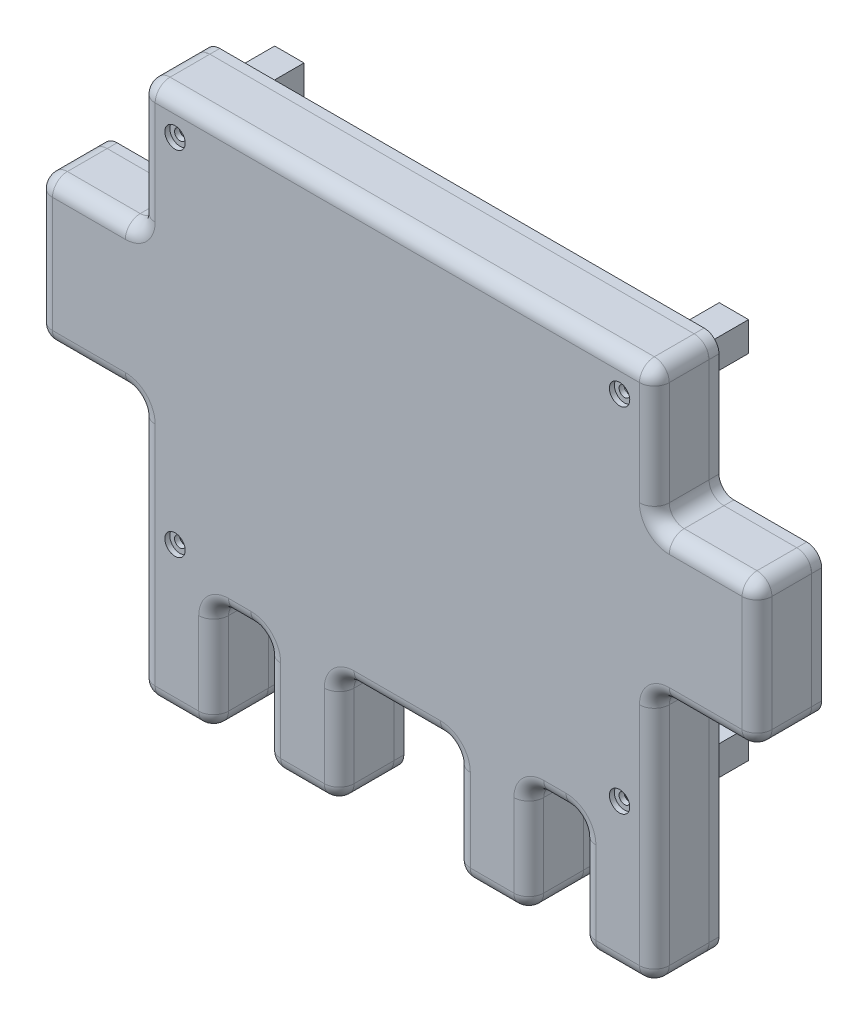
from build123d import *

# Parameters (mm, degrees)
PADTOP_W                  = 77.3
PADTOP_H                  = 39.099999999999994
PADTOP_W_2                = 20.65574575464899
PADTOP_H_2                = 29.19565574217878
PADTOP_R                  = 4.499999999999992
PADTOP_W_3                = 14.763576239839747
PADTOP_H_3                = 22.646815710584427
PADTOP_W_4                = 14.76357623983975
PADTOP_H_4                = 22.646815710584438
EXTRUDE_1_DEPTH           = 3
EXTRUDE_START             = -2
PADTOP_8_W                = 14.100000000000016
PADTOP_8_H                = 14.100000000000009
PADTOP_8_W_2              = 14.099999999999994
PADTOP_8_W_3              = 14.100000000000023
PADTOP_8_W_4              = 14.100000000000001
PADTOP_8_H_2              = 14.100000000000001
PADTOP_8_H_3              = 14.100000000000005
PADTOP_8_R                = 4.499999999999992
EXTRUDE_4_DEPTH           = 2
EXTRUDE_6_DEPTH           = 11
FILLET_2_R                = 3
SHELL_1_T                 = -2
FILLET_4_R                = 3
SKETCH_5_W                = 2
SKETCH_5_H                = 2.0000000000000018
SKETCH_5_W_2              = 3.999999999999986
SKETCH_5_H_2              = 4.000000000000002
SKETCH_5_W_3              = 4
SKETCH_5_W_4              = 2.000000000000014
SKETCH_5_W_5              = 4.000000000000007
SKETCH_5_H_3              = 4
SKETCH_5_W_6              = 3.9999999999999787
SKETCH_5_W_7              = 5.8999999999999915
SKETCH_5_H_4              = 5.900000000000001
SKETCH_5_W_8              = 1.8999999999999915
SKETCH_5_H_5              = 1.8999999999999986
SKETCH_5_H_6              = 5.900000000000006
SKETCH_5_W_9              = 1.9000000000000057
SKETCH_5_H_7              = 1.8999999999999915
SKETCH_5_W_10             = 5.899999999999999
SKETCH_5_W_11             = 1.899999999999995
EXTRUDE_9_DEPTH           = 10
SKETCH_7_R                = 1.1000000000000003
SKETCH_7_R_2              = 1.100000000000007
SKETCH_7_R_3              = 1.100000000000006
SKETCH_7_R_4              = 1.0999999999999992
CUT_EXTRUDE_1_DEPTH       = 2
CUT_EXTRUDE_START         = 10
CUT_EXTRUDE_2_OUTLINE_R   = 2.05
CUT_EXTRUDE_2_OUTLINE_R_2 = 1.1
CUT_EXTRUDE_2_DEPTH       = 1


# Read off the part's stored shape, not the designer's step: 除料-伸長2
with BuildPart() as part:
    # padTop → 填料-伸長1 (new body)
    # profile 1 of 9: a face of its own
    with BuildSketch(Plane.XY):
        Polygon((124.13033501568816, 70.45257702927987), (20.69269788144798, 70.45257702927987), (20.69269788144798, 43.68260894391669), (20.69269788144798, 38.79106377956692), (24.836952126799048, 38.79106377956692), (24.836952126799048, 19.37849836608769), (20.692697881447977, 19.37849836608769), (20.69269788144798, 14.486953201737919), (20.69269788144798, -14.488569064052683), (35.45627412128773, -14.488569064052687), (45.95627412128772, -14.488569064052687), (60.719850361127456, -14.488569064052687), (84.10318253600873, -14.488569064052687), (98.86675877584847, -14.488569064052687), (109.3667587758484, -14.488569064052687), (124.13033501568816, -14.488569064052687), (124.13033501568816, 14.309507687934257), (124.13033501568816, 43.505163430113036), align=None)
        with Locations((72.41151644856805, 11.013549731684844)):
            Rectangle(PADTOP_W, PADTOP_H, mode=Mode.SUBTRACT)
        Polygon((32.9132584783268, 41.22637289448324), (32.91325847832679, 61.22637289448325), (52.913258478326796, 61.22637289448325), (52.9132584783268, 41.22637289448324), align=None, mode=Mode.SUBTRACT)
        Polygon((92.073451812104, 41.22637289448324), (92.073451812104, 61.22637289448324), (112.073451812104, 61.22637289448325), (112.07345181210398, 41.22637289448324), align=None, mode=Mode.SUBTRACT)
    # profile 2 of 9: a face of its own
    with BuildSketch(Plane.XY):
        with Locations((134.45820789301266, 28.907335559023647)):
            Rectangle(PADTOP_W_2, PADTOP_H_2)
        with Locations((129.98608077033714, 29.084781072827305)):
            Circle(PADTOP_R, mode=Mode.SUBTRACT)
    # profile 3 of 9: a face of its own
    with BuildSketch(Plane.XY):
        Polygon((20.69269788144798, 38.79106377956692), (20.69269788144798, 43.68260894391669), (0.03695212679904358, 43.68260894391669), (0.03695212679905203, 14.486953201737915), (20.69269788144798, 14.486953201737915), (20.69269788144798, 19.37849836608769), (4.836952126799051, 19.378498366087687), (4.836952126799049, 38.79106377956692), align=None)
    # profile 4 of 9: a face of its own
    with BuildSketch(Plane.XY):
        Polygon((112.073451812104, 61.22637289448325), (112.07345181210398, 41.22637289448324), (92.073451812104, 41.22637289448324), (92.073451812104, 61.22637289448324), align=None)
        Polygon((96.52345181210397, 56.776372894483245), (107.62345181210398, 56.776372894483245), (107.62345181210398, 45.676372894483244), (96.52345181210399, 45.676372894483244), align=None, mode=Mode.SUBTRACT)
    # profile 5 of 9: a face of its own
    with BuildSketch(Plane.XY):
        Polygon((52.913258478326796, 61.22637289448325), (52.9132584783268, 41.22637289448324), (32.9132584783268, 41.22637289448324), (32.91325847832679, 61.22637289448325), align=None)
        Polygon((37.36325847832679, 56.776372894483245), (48.46325847832679, 56.776372894483245), (48.46325847832679, 45.676372894483244), (37.363258478326784, 45.676372894483244), align=None, mode=Mode.SUBTRACT)
    # profile 6 of 9: a face of its own
    with BuildSketch(Plane.XY):
        with Locations((28.074486001367852, -25.811976919344897)):
            Rectangle(PADTOP_W_3, PADTOP_H_3)
    # profile 7 of 9: a face of its own
    with BuildSketch(Plane.XY):
        Polygon((45.95627412128772, -14.488569064052673), (45.95627412128772, -37.13538477463711), (60.719850361127456, -37.13538477463711), (60.71985036112745, -14.488569064052673), align=None)
    # profile 8 of 9: a face of its own
    with BuildSketch(Plane.XY):
        with Locations((91.4849706559286, -25.811976919344893)):
            Rectangle(PADTOP_W_4, PADTOP_H_4)
    # profile 9 of 9: a face of its own
    with BuildSketch(Plane.XY):
        Polygon((124.13033501568816, -14.488569064052687), (124.13033501568816, -37.13538477463711), (109.3667587758484, -37.13538477463711), (109.3667587758484, -14.488569064052696), align=None)
    extrude(amount=EXTRUDE_1_DEPTH)

    # padTop<8> → 填料-伸長4 (add)
    with BuildSketch(Plane.XY.offset(EXTRUDE_START)):
        Polygon((124.13033501568816, 70.45257702927987), (20.69269788144798, 70.45257702927987), (20.69269788144797, 43.682608943916684), (0.03695212679904358, 43.68260894391669), (0.03695212679905203, 14.486953201737915), (20.69269788144798, 14.486953201737915), (20.69269788144798, -37.13538477463711), (35.45627412128773, -37.13538477463711), (35.45627412128773, -14.488569064052687), (45.95627412128772, -14.488569064052687), (45.95627412128772, -37.13538477463711), (60.719850361127456, -37.13538477463711), (60.71985036112745, -14.488569064052673), (84.10318253600873, -14.488569064052685), (84.10318253600873, -37.13538477463711), (98.86675877584847, -37.13538477463711), (98.86675877584847, -14.488569064052673), (109.3667587758484, -14.488569064052685), (109.3667587758484, -37.13538477463711), (124.13033501568816, -37.13538477463711), (124.13033501568816, 14.309507687934257), (144.78608077033715, 14.309507687934257), (144.78608077033715, 43.505163430113036), (124.13033501568816, 43.505163430113036), align=None)
        with Locations((43.76151644856806, 1.463549731684843)):
            Rectangle(PADTOP_8_W, PADTOP_8_H, mode=Mode.SUBTRACT)
        with Locations((62.86151644856807, 1.4635497316848411)):
            Rectangle(PADTOP_8_W_2, PADTOP_8_H, mode=Mode.SUBTRACT)
        Polygon((74.9115164485681, -5.586450268315154), (74.91151644856807, 8.513549731684844), (89.01151644856807, 8.513549731684845), (89.01151644856807, -5.586450268315156), align=None, mode=Mode.SUBTRACT)
        with Locations((101.06151644856807, 1.463549731684843)):
            Rectangle(PADTOP_8_W_3, PADTOP_8_H, mode=Mode.SUBTRACT)
        with Locations((43.76151644856806, 20.563549731684844)):
            Rectangle(PADTOP_8_W_4, PADTOP_8_H_2, mode=Mode.SUBTRACT)
        Polygon((55.81151644856807, 13.51354973168484), (55.81151644856807, 27.613549731684838), (69.91151644856808, 27.613549731684838), (69.91151644856808, 13.513549731684842), align=None, mode=Mode.SUBTRACT)
        Polygon((74.91151644856808, 13.51354973168484), (74.91151644856807, 27.613549731684838), (89.01151644856807, 27.613549731684834), (89.01151644856807, 13.51354973168484), align=None, mode=Mode.SUBTRACT)
        with Locations((101.06151644856809, 20.563549731684844)):
            Rectangle(PADTOP_8_W_2, PADTOP_8_H_3, mode=Mode.SUBTRACT)
        Polygon((20.692697881447977, 22.034781072827304), (7.786952126799051, 22.034781072827304), (7.786952126799052, 36.134781072827295), (20.69269788144797, 36.134781072827295), align=None, mode=Mode.SUBTRACT)
        Polygon((92.073451812104, 41.22637289448324), (92.073451812104, 61.22637289448324), (112.073451812104, 61.22637289448325), (112.07345181210398, 41.22637289448324), align=None, mode=Mode.SUBTRACT)
        Polygon((32.9132584783268, 41.22637289448324), (32.91325847832679, 61.22637289448325), (52.913258478326796, 61.22637289448325), (52.9132584783268, 41.22637289448324), align=None, mode=Mode.SUBTRACT)
        with Locations((129.98608077033714, 29.084781072827305)):
            Circle(PADTOP_8_R, mode=Mode.SUBTRACT)
    extrude(amount=EXTRUDE_4_DEPTH)

    # 圓角4
    fillet_4_edges = [part.edges().sort_by_distance(p)[0] for p in [
        (10.364825004123515, 14.486953201737915, 3),
        (35.45627412128773, -37.13538477463711, 0.5),
        (20.69269788144798, -37.13538477463711, 0.5),
        (35.45627412128773, -25.8119769193449, 3),
        (28.074486001367852, -37.13538477463711, 3),
        (60.719850361127456, -37.13538477463711, 0.5),
        (45.95627412128772, -37.13538477463711, 0.5),
        (45.95627412128772, -25.811976919344893, 3),
        (60.719850361127456, -25.811976919344893, 3),
        (53.33806224120759, -37.13538477463711, 3),
        (98.86675877584847, -37.13538477463711, 0.5),
        (84.10318253600873, -37.13538477463711, 0.5),
        (84.10318253600873, -25.811976919344893, 3),
        (98.86675877584847, -25.811976919344893, 3),
        (91.4849706559286, -37.13538477463711, 3),
        (124.13033501568816, -37.13538477463711, 0.5),
        (109.3667587758484, -37.13538477463711, 0.5),
        (109.3667587758484, -25.811976919344904, 3),
        (116.74854689576827, -37.13538477463711, 3),
        (20.69269788144798, -11.324215786449598, 3),
        (124.13033501568816, -11.412938543351427, 3),
        (134.45820789301266, 14.309507687934257, 3),
        (144.78608077033715, 28.907335559023647, 3),
        (134.45820789301266, 43.505163430113036, 3),
        (124.13033501568816, 56.978870229696454, 3),
        (72.41151644856808, 70.45257702927987, 3),
        (0.03695212679905136, 14.486953201737915, 0.5),
        (0.03695212679904334, 43.68260894391669, 0.5),
        (20.692697881447963, 43.68260894391669, 0.5),
        (20.69269788144798, 70.45257702927987, 0.5),
        (124.13033501568816, 70.45257702927987, 0.5),
        (124.13033501568816, 43.505163430113036, 0.5),
        (144.78608077033715, 43.505163430113036, 0.5),
        (144.78608077033715, 14.309507687934257, 0.5),
        (124.13033501568816, 14.309507687934257, 0.5),
        (20.69269788144798, 57.06759298659828, 3),
        (20.69269788144798, 14.486953201737915, 0.5),
        (10.364825004123498, 43.68260894391669, 3),
        (0.03695212679904757, 29.084781072827305, 3),
        (40.70627412128772, -14.488569064052685, 3),
        (72.4115164485681, -14.488569064052685, 3),
        (104.11675877584844, -14.488569064052685, 3),
        (109.3667587758484, -14.488569064052694, 0.5),
        (98.86675877584847, -14.488569064052676, 0.5),
        (84.10318253600873, -14.488569064052676, 0.5),
        (60.719850361127456, -14.488569064052676, 0.5),
        (45.95627412128772, -14.488569064052676, 0.5),
        (35.45627412128773, -14.488569064052687, 0.5),
    ]]
    fillet(fillet_4_edges, radius=FILLET_4_R)

    # 草圖5 → 填料-伸長9 (add)
    # profile 1 of 14: a face of its own
    with BuildSketch(Plane.XY.offset(-2)):
        with Locations((91.51151644856806, 11.01354973168485)):
            Rectangle(SKETCH_5_W, SKETCH_5_H)
    # profile 2 of 14: a face of its own
    with BuildSketch(Plane.XY.offset(-2)):
        with Locations((88.51151644856807, 11.01354973168485)):
            Rectangle(SKETCH_5_W_2, SKETCH_5_H)
    # profile 3 of 14: a face of its own
    with BuildSketch(Plane.XY.offset(-2)):
        with Locations((91.51151644856806, 14.013549731684854)):
            Rectangle(SKETCH_5_W, SKETCH_5_H_2)
    # profile 4 of 14: a face of its own
    with BuildSketch(Plane.XY.offset(-2)):
        Polygon((92.51151644856806, 10.01354973168485), (90.51151644856806, 10.01354973168485), (90.51151644856806, 6.013549731684851), (92.51151644856806, 6.013549731684852), align=None)
    # profile 5 of 14: a face of its own
    with BuildSketch(Plane.XY.offset(-2)):
        with Locations((94.51151644856806, 11.01354973168485)):
            Rectangle(SKETCH_5_W_3, SKETCH_5_H)
    # profile 6 of 14: a face of its own
    with BuildSketch(Plane.XY.offset(-2)):
        with Locations((53.311516448568064, 11.013549731684847)):
            Rectangle(SKETCH_5_W_4, SKETCH_5_H)
    # profile 7 of 14: a face of its own
    with BuildSketch(Plane.XY.offset(-2)):
        with Locations((50.31151644856806, 11.013549731684847)):
            Rectangle(SKETCH_5_W_5, SKETCH_5_H)
    # profile 8 of 14: a face of its own
    with BuildSketch(Plane.XY.offset(-2)):
        with Locations((53.311516448568064, 14.013549731684847)):
            Rectangle(SKETCH_5_W_4, SKETCH_5_H_3)
    # profile 9 of 14: a face of its own
    with BuildSketch(Plane.XY.offset(-2)):
        with Locations((56.31151644856806, 11.013549731684847)):
            Rectangle(SKETCH_5_W_6, SKETCH_5_H)
    # profile 10 of 14: a face of its own
    with BuildSketch(Plane.XY.offset(-2)):
        Polygon((54.311516448568064, 10.013549731684845), (52.31151644856806, 10.013549731684845), (52.31151644856806, 6.013549731684847), (54.311516448568064, 6.013549731684846), align=None)
    # profile 11 of 14: a face of its own
    with BuildSketch(Plane.XY.offset(-2)):
        Polygon((30.64269788144798, -4.538569064052686), (30.64269788144798, -10.438569064052688), (24.742697881447977, -10.438569064052688), (24.742697881447977, -4.538569064052685), align=None)
        Polygon((26.74269788144798, -6.538569064052687), (28.64269788144798, -6.538569064052687), (28.64269788144798, -8.438569064052686), (26.74269788144798, -8.438569064052684), align=None, mode=Mode.SUBTRACT)
    # profile 12 of 14: a face of its own
    with BuildSketch(Plane.XY.offset(-2)):
        with Locations((117.13033501568813, -7.488569064052683)):
            Rectangle(SKETCH_5_W_7, SKETCH_5_H_4)
        with Locations((117.13033501568813, -7.488569064052687)):
            Rectangle(SKETCH_5_W_8, SKETCH_5_H_5, mode=Mode.SUBTRACT)
    # profile 13 of 14: a face of its own
    with BuildSketch(Plane.XY.offset(-2)):
        with Locations((117.13033501568813, 63.45257702927985)):
            Rectangle(SKETCH_5_W_7, SKETCH_5_H_6)
        with Locations((117.13033501568816, 63.45257702927986)):
            Rectangle(SKETCH_5_W_9, SKETCH_5_H_7, mode=Mode.SUBTRACT)
    # profile 14 of 14: a face of its own
    with BuildSketch(Plane.XY.offset(-2)):
        with Locations((27.692697881447994, 63.45257702927985)):
            Rectangle(SKETCH_5_W_10, SKETCH_5_H_6)
        with Locations((27.692697881447984, 63.452577029279844)):
            Rectangle(SKETCH_5_W_11, SKETCH_5_H_7, mode=Mode.SUBTRACT)
    extrude(amount=-EXTRUDE_9_DEPTH)


with BuildPart() as body_2:
    # 草圖2 → 填料-伸長6 (new body)
    with BuildSketch(Plane.XY):
        Polygon((20.692697881447952, 43.68260894391669), (0.0369521267990431, 43.68260894391669), (0.03695212679905203, 14.486953201737915), (20.69269788144798, 14.486953201737915), (20.69269788144798, -37.13538477463711), (35.45627412128773, -37.13538477463711), (35.45627412128773, -14.488569064052687), (45.95627412128772, -14.488569064052673), (45.95627412128772, -37.13538477463711), (60.719850361127456, -37.13538477463711), (60.71985036112745, -14.488569064052673), (84.10318253600873, -14.488569064052673), (84.10318253600873, -37.13538477463711), (98.86675877584847, -37.13538477463711), (98.86675877584847, -14.488569064052673), (109.3667587758484, -14.488569064052696), (109.3667587758484, -37.13538477463711), (124.13033501568816, -37.13538477463711), (124.13033501568816, 14.309507687934257), (144.78608077033715, 14.309507687934257), (144.78608077033715, 43.505163430113036), (124.13033501568816, 43.505163430113036), (124.13033501568816, 70.45257702927987), (20.69269788144798, 70.45257702927987), align=None)
    extrude(amount=EXTRUDE_6_DEPTH)

    # 圓角2
    fillet_2_edges = [body_2.edges().sort_by_distance(p)[0] for p in [
        (0.03695212679904757, 29.084781072827305, 11),
        (10.364825004123517, 14.486953201737915, 11),
        (20.69269788144798, -11.324215786449596, 11),
        (28.074486001367852, -37.13538477463711, 11),
        (35.45627412128773, -25.8119769193449, 11),
        (40.70627412128772, -14.48856906405268, 11),
        (45.95627412128772, -25.811976919344893, 11),
        (20.69269788144798, 70.45257702927987, 5.5),
        (124.13033501568816, 70.45257702927987, 5.5),
        (124.13033501568816, 43.505163430113036, 5.5),
        (144.78608077033715, 43.505163430113036, 5.5),
        (144.78608077033715, 14.309507687934257, 5.5),
        (124.13033501568816, 14.309507687934257, 5.5),
        (124.13033501568816, -37.13538477463711, 5.5),
        (109.3667587758484, -37.13538477463711, 5.5),
        (109.3667587758484, -14.488569064052696, 5.5),
        (98.86675877584847, -14.488569064052673, 5.5),
        (98.86675877584847, -37.13538477463711, 5.5),
        (53.33806224120759, -37.13538477463711, 11),
        (84.10318253600873, -37.13538477463711, 5.5),
        (84.10318253600873, -14.488569064052673, 5.5),
        (60.71985036112745, -14.488569064052673, 5.5),
        (60.719850361127456, -37.13538477463711, 5.5),
        (45.95627412128772, -37.13538477463711, 5.5),
        (45.95627412128772, -14.488569064052673, 5.5),
        (35.45627412128773, -14.488569064052687, 5.5),
        (35.45627412128773, -37.13538477463711, 5.5),
        (20.69269788144798, -37.13538477463711, 5.5),
        (20.69269788144798, 14.486953201737915, 5.5),
        (0.03695212679905203, 14.486953201737915, 5.5),
        (0.0369521267990431, 43.68260894391669, 5.5),
        (20.692697881447952, 43.68260894391669, 5.5),
        (60.719850361127456, -25.811976919344893, 11),
        (72.4115164485681, -14.488569064052673, 11),
        (20.692697881447966, 57.06759298659828, 11),
        (84.10318253600873, -25.811976919344893, 11),
        (91.4849706559286, -37.13538477463711, 11),
        (98.86675877584847, -25.811976919344893, 11),
        (104.11675877584844, -14.488569064052685, 11),
        (109.3667587758484, -25.8119769193449, 11),
        (116.74854689576827, -37.13538477463711, 11),
        (124.13033501568816, -11.412938543351427, 11),
        (134.45820789301266, 14.309507687934257, 11),
        (144.78608077033715, 28.907335559023647, 11),
        (134.45820789301266, 43.505163430113036, 11),
        (10.364825004123498, 43.68260894391669, 11),
        (124.13033501568816, 56.978870229696454, 11),
        (72.41151644856808, 70.45257702927987, 11),
    ]]
    fillet(fillet_2_edges, radius=FILLET_2_R)

    # 薄殼1
    shell_1_openings = [body_2.faces().sort_by_distance(p)[0] for p in [
        (72.411516449, 21.765183813, 0),
    ]]
    offset(amount=SHELL_1_T, openings=shell_1_openings, kind=Kind.INTERSECTION)

    # 草圖7 → 除料-伸長1 (cut)
    with BuildSketch(Plane.XY.offset(11)):
        with Locations((27.692697881447987, 63.45257702927985)):
            Circle(SKETCH_7_R)
        with Locations((117.13033501568815, 63.45257702927985)):
            Circle(SKETCH_7_R_2)
        with Locations((117.13033501568815, -7.488569064052687)):
            Circle(SKETCH_7_R_3)
        with Locations((27.69269788144798, -7.488569064052687)):
            Circle(SKETCH_7_R_4)
    extrude(amount=-CUT_EXTRUDE_1_DEPTH, mode=Mode.SUBTRACT)

    # 除料-伸長2 outline → 除料-伸長2 (cut)
    # profile 1 of 4: a face of its own
    with BuildSketch(Plane.XY.offset(CUT_EXTRUDE_START)):
        with Locations((27.692697881, -7.488569064)):
            Circle(CUT_EXTRUDE_2_OUTLINE_R)
        with Locations((27.692697881, -7.488569064)):
            Circle(CUT_EXTRUDE_2_OUTLINE_R_2, mode=Mode.SUBTRACT)
    # profile 2 of 4: a face of its own
    with BuildSketch(Plane.XY.offset(CUT_EXTRUDE_START)):
        with Locations((117.130335016, 63.452577029)):
            Circle(CUT_EXTRUDE_2_OUTLINE_R)
        with Locations((117.130335016, 63.452577029)):
            Circle(CUT_EXTRUDE_2_OUTLINE_R_2, mode=Mode.SUBTRACT)
    # profile 3 of 4: a face of its own
    with BuildSketch(Plane.XY.offset(CUT_EXTRUDE_START)):
        with Locations((27.692697881, 63.452577029)):
            Circle(CUT_EXTRUDE_2_OUTLINE_R)
        with Locations((27.692697881, 63.452577029)):
            Circle(CUT_EXTRUDE_2_OUTLINE_R_2, mode=Mode.SUBTRACT)
    # profile 4 of 4: a face of its own
    with BuildSketch(Plane.XY.offset(CUT_EXTRUDE_START)):
        with Locations((117.130335016, -7.488569064)):
            Circle(CUT_EXTRUDE_2_OUTLINE_R)
        with Locations((117.130335016, -7.488569064)):
            Circle(CUT_EXTRUDE_2_OUTLINE_R_2, mode=Mode.SUBTRACT)
    extrude(amount=CUT_EXTRUDE_2_DEPTH, mode=Mode.SUBTRACT)


solid = Compound([part.part, body_2.part])
